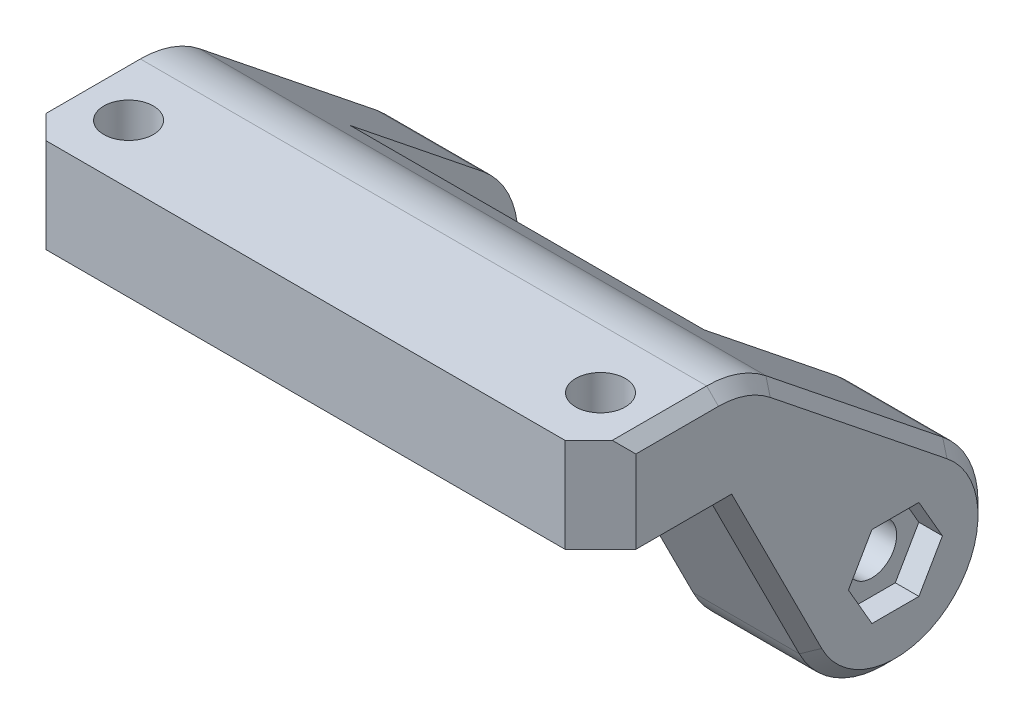
from build123d import *

# Parameters (mm, degrees)
CROQUIS1_W              = 50
CROQUIS1_H              = 10
CROQUIS1_R              = 2.1
SALIENTE_EXTRUIR1_DEPTH = 8
CROQUIS4_R              = 2.1
SALIENTE_EXTRUIR2_DEPTH = 25
CROQUIS5_R              = 15.800490208
CORTAR_EXTRUIR1_DEPTH   = 15
CORTAR_EXTRUIR2_DEPTH   = 2
CHAFL_N1_SIZE           = 3
CORTAR_EXTRUIR3_DEPTH   = 2
CHAFL_N2_SIZE           = 1
CHAFL_N2_SIZE_2         = 0.730640075


with BuildPart() as part:
    # Croquis1 → Saliente-Extruir1 (new body)
    with BuildSketch(Plane(origin=(0, 0, 0), x_dir=(1, 0, 0), z_dir=(0, 1, 0))):
        Rectangle(CROQUIS1_W, CROQUIS1_H)
        with Locations(Location((20, 0, 0), (0, 0, 270))):
            Circle(CROQUIS1_R, mode=Mode.SUBTRACT)
        with Locations(Location((-20, 0, 0), (0, 0, 90))):
            Circle(CROQUIS1_R, mode=Mode.SUBTRACT)
    extrude(amount=SALIENTE_EXTRUIR1_DEPTH)

    # Croquis4 → Saliente-Extruir2 (add, symmetric)
    with BuildSketch(Plane(origin=(0, 0, 0), x_dir=(0, 0, -1), z_dir=(1, 0, 0))):
        with BuildLine():
            Line((5, 8), (5, 0))
            Line((5, 0), (12.854829477, -15.59812982))
            ThreePointArc((12.854829477, -15.59812982), (25.037274777, -18.214970863), (24.999619637, -5.754697487))
            Line((24.999619637, -5.754697487), (10.01766425, 6.238969464))
            ThreePointArc((10.01766425, 6.238969464), (7.658861743, 7.54696071), (5, 8))
        make_face()
        with Locations((20, -12)):
            Circle(CROQUIS4_R, mode=Mode.SUBTRACT)
    extrude(amount=SALIENTE_EXTRUIR2_DEPTH, both=True)

    # Croquis5 → Cortar-Extruir1 (cut, symmetric)
    with BuildSketch(Plane(origin=(0, 0, 0), x_dir=(0, 0, -1), z_dir=(1, 0, 0))):
        with Locations((20, -12)):
            Circle(CROQUIS5_R)
    extrude(amount=CORTAR_EXTRUIR1_DEPTH, both=True, mode=Mode.SUBTRACT)

    # Croquis6 → Cortar-Extruir2 (cut, symmetric)
    with BuildSketch(Plane.ZY.offset(25)):
        Polygon((-16.016283143, -12), (-18.008141571, -8.55), (-21.991858429, -8.55), (-23.983716857, -12), (-21.991858429, -15.45), (-18.008141571, -15.45), align=None)
    cortar_extruir2 = extrude(amount=CORTAR_EXTRUIR2_DEPTH, both=True, mode=Mode.SUBTRACT)

    # Simetría1: Cortar-Extruir2 across plane
    add(cortar_extruir2.mirror(Plane(origin=(0, 0, 0), x_dir=(0, 0, 1), z_dir=(1, 0, 0))), mode=Mode.SUBTRACT)

    # Chaflán1
    chafl_n1_edges = [part.edges().sort_by_distance(p)[0] for p in [
        (25, 4, 5),
        (-25, 4, 5),
    ]]
    chamfer(chafl_n1_edges, length=CHAFL_N1_SIZE)

    # Croquis7 → Cortar-Extruir3 (cut, symmetric)
    with BuildSketch(Plane.XZ):
        Polygon((-16.016283143, 0), (-18.008141571, 3.45), (-21.991858429, 3.45), (-23.983716857, 0), (-21.991858429, -3.45), (-18.008141571, -3.45), align=None)
        Polygon((18.008141571, -3.45), (16.016283143, 0), (18.008141571, 3.45), (21.991858429, 3.45), (23.983716857, 0), (21.991858429, -3.45), align=None)
    extrude(amount=CORTAR_EXTRUIR3_DEPTH, both=True, mode=Mode.SUBTRACT)

    # Chaflán2
    # the kernel refuses this chamfer: 1, 0.730640075 mm, written as the material it takes off along each edge
    with BuildSketch(Plane(origin=(25, 8, -5), x_dir=(0, -1, 0), z_dir=(0, 0, 1))) as chafl_n2_piece_1:
        Polygon((CHAFL_N2_SIZE, 0), (0, -CHAFL_N2_SIZE), (0, 0), align=None)
    extrude(amount=9.571682988, mode=Mode.SUBTRACT)
    with BuildSketch(Plane(origin=(-25, 8, 4.571682988), x_dir=(1, 0, 0), z_dir=(0, 0, -1))) as chafl_n2_piece_2:
        Polygon((CHAFL_N2_SIZE, 0), (0, CHAFL_N2_SIZE), (0, 0), align=None)
    extrude(amount=9.571682988, mode=Mode.SUBTRACT)
    with BuildSketch(Plane(origin=(25, -12, -20), x_dir=(0, -0.44976622750296646, 0.8931463153357069), z_dir=(0, 0.8931463153357069, 0.44976622750296646))) as chafl_n2_piece_3:
        Polygon((8 - CHAFL_N2_SIZE, 0), (8, -CHAFL_N2_SIZE), (8, 0), align=None)
    revolve(axis=Axis((25, -12, -20), (1, 0, 0)), revolution_arc=204.592615825, mode=Mode.SUBTRACT)
    with BuildSketch(Plane(origin=(25, -5.754697487, -24.999619637), x_dir=(0, -0.7806628141857404, 0.6249524546296304), z_dir=(0, 0.6249524546296304, 0.7806628141857404)), Plane(origin=(-25, -5.754697487, -24.999619637), x_dir=(1, 0, 0), z_dir=(0, 0.6249524546296304, 0.7806628141857404))) as chafl_n2_piece_4:
        Polygon((CHAFL_N2_SIZE, 0), (0, -CHAFL_N2_SIZE), (0, 0), align=None)
    extrude(amount=19.191327055, mode=Mode.SUBTRACT)
    with BuildSketch(Plane(origin=(25, -0.028873577, -5), x_dir=(0, 0.7806628141857421, -0.6249524546296281), z_dir=(0, -0.6249524546296281, -0.7806628141857421))) as chafl_n2_piece_5:
        Polygon((8.028873577 - CHAFL_N2_SIZE, 0), (8.028873577, -CHAFL_N2_SIZE), (8.028873577, 0), align=None)
    revolve(axis=Axis((25, -0.028873577, -5), (1, 0, 0)), revolution_arc=38.678697835, mode=Mode.SUBTRACT)
    with BuildSketch(Plane(origin=(25, 2.296889185, -3.843343844), x_dir=(0, 0.44976622750296674, -0.8931463153357067), z_dir=(0, -0.8931463153357067, -0.44976622750296674))) as chafl_n2_piece_6_section:
        Polygon((CHAFL_N2_SIZE, 0), (0, -CHAFL_N2_SIZE), (0, 0), align=None)
    chafl_n2_piece_6 = extrude(amount=20.035932185, mode=Mode.PRIVATE)
    chafl_n2_piece_6 = split(chafl_n2_piece_6, bisect_by=Plane(origin=(25, 0, -3.843343844), z_dir=(0, -1, 0)), keep=Keep.TOP, mode=Mode.PRIVATE)
    add(chafl_n2_piece_6, mode=Mode.SUBTRACT)
    with BuildSketch(Plane(origin=(-25, -12, -20), x_dir=(0, -0.44976622750296646, 0.8931463153357069), z_dir=(0, 0.8931463153357069, 0.44976622750296646))) as chafl_n2_piece_7:
        Polygon((8 - CHAFL_N2_SIZE, 0), (8, CHAFL_N2_SIZE), (8, 0), align=None)
    revolve(axis=Axis((-25, -12, -20), (1, 0, 0)), revolution_arc=204.592615825, mode=Mode.SUBTRACT)
    with BuildSketch(Plane(origin=(-25, -0.028873577, -5), x_dir=(0, 0.7806628141857421, -0.6249524546296281), z_dir=(0, -0.6249524546296281, -0.7806628141857421))) as chafl_n2_piece_8:
        Polygon((8.028873577, CHAFL_N2_SIZE), (8.028873577 - CHAFL_N2_SIZE, 0), (8.028873577, 0), align=None)
    revolve(axis=Axis((-25, -0.028873577, -5), (1, 0, 0)), revolution_arc=38.678697835, mode=Mode.SUBTRACT)
    with BuildSketch(Plane(origin=(-25, 2.296889185, -3.843343844), x_dir=(1, 0, 0), z_dir=(0, -0.8931463153357067, -0.44976622750296674))) as chafl_n2_piece_9_section:
        Polygon((CHAFL_N2_SIZE, 0), (0, -CHAFL_N2_SIZE), (0, 0), align=None)
    chafl_n2_piece_9 = extrude(amount=20.035932185, mode=Mode.PRIVATE)
    chafl_n2_piece_9 = split(chafl_n2_piece_9, bisect_by=Plane(origin=(-25, 0, -3.843343844), z_dir=(0, -1, 0)), keep=Keep.TOP, mode=Mode.PRIVATE)
    add(chafl_n2_piece_9, mode=Mode.SUBTRACT)
    with BuildSketch(Plane(origin=(-15, -3.428524041, -6.72651927), x_dir=(0, 0.8931463153357074, 0.44976622750296513), z_dir=(1, 0, 0))) as chafl_n2_piece_10:
        with BuildLine():
            Line((CHAFL_N2_SIZE_2, 0), (0.494257976, -0.908692648))
            ThreePointArc((0.494257976, -0.908692648), (0.261545908, -0.46314506), (0, 0))
            Line((0, 0), (CHAFL_N2_SIZE_2, 0))
        make_face()
    extrude(amount=30, mode=Mode.SUBTRACT)
    with BuildSketch(Plane(origin=(-15, 2.760620634, -14.362662924), x_dir=(0, 0.6249524546296293, 0.7806628141857411), z_dir=(1, 0, 0))) as chafl_n2_piece_11:
        with BuildLine():
            Line((CHAFL_N2_SIZE_2, 0), (0.494257976, 0.908692648))
            ThreePointArc((0.494257976, 0.908692648), (0.261545908, 0.46314506), (0, 0))
            Line((0, 0), (CHAFL_N2_SIZE_2, 0))
        make_face()
    extrude(amount=30, mode=Mode.SUBTRACT)


solid = part.part
